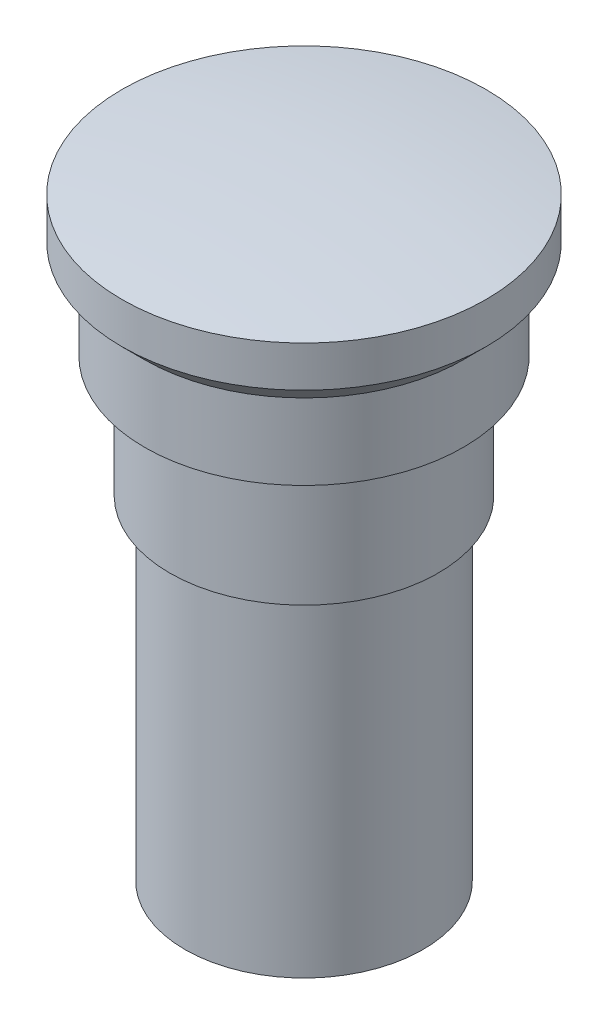
from build123d import *

# Parameters (mm, degrees)
CHAMFER_1_SIZE = 1.5


with BuildPart() as part:
    # 草图1 → 旋转1 (revolve)
    with BuildSketch(Plane.XY, mode=Mode.PRIVATE) as revolve_1_sk:
        with BuildLine():
            Line((0, 0), (-7.85, 0))
            Line((-7.85, 0), (-7.85, 22))
            Line((-7.85, 22), (-8.85, 22))
            Line((-8.85, 22), (-8.85, 30))
            Line((-8.85, 30), (-10.5, 30))
            Line((-10.5, 30), (-10.5, 35))
            Line((-10.5, 35), (-12, 35))
            Line((-12, 35), (-12, 39.196412484))
            ThreePointArc((-12, 39.196412484), (-6.013438137, 39.798878399), (0, 40))
            Line((0, 40), (0, 0))
        make_face()
    revolve(revolve_1_sk.sketch.rotate(Axis((0, 40, 0), (0, -1, 0)), 270), axis=Axis((0, 40, 0), (0, -1, 0)))

    # 倒角1
    chamfer_1_edges = [part.edges().sort_by_distance(p)[0] for p in [
        (0, 35, -12),
    ]]
    chamfer(chamfer_1_edges, length=CHAMFER_1_SIZE - 0.0001)  # a hair under: the kernel refuses the full size


solid = part.part
